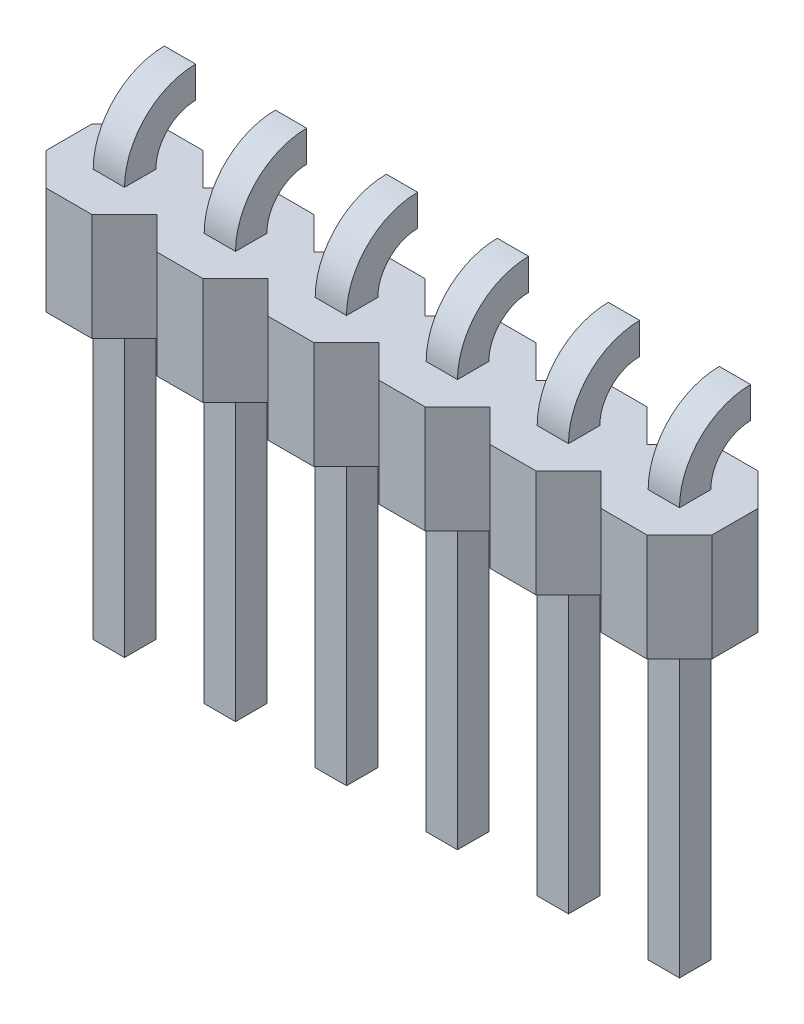
from build123d import *

# Parameters (mm, degrees)
SKETCH1_W                   = 0.7
SKETCH1_H                   = 0.7
BOSS_EXTRUDE1_DEPTH         = 9.1
BOSS_EXTRUDE1_2_DEPTH       = 9.1
BOSS_EXTRUDE1_3_DEPTH       = 9.1
BOSS_EXTRUDE1_4_DEPTH       = 9.1
BOSS_EXTRUDE1_5_DEPTH       = 9.1
BOSS_EXTRUDE1_6_DEPTH       = 9.1
SKETCH3_W                   = 0.7
SKETCH3_H                   = 0.7
Y_KSEKLIK_EKSTR_ZYON1_DEPTH = 2.4
IZIM1_W                     = 0.7
IZIM1_H                     = 0.7
D_ND_R1_ANGLE               = 90


with BuildPart() as part:
    # Sketch1 → Boss-Extrude1 (new body)
    with BuildSketch(Plane(origin=(0, 0, 0), x_dir=(1, 0, 0), z_dir=(0, 1, 0))):
        with Locations((2.48, 0)):
            Rectangle(SKETCH1_W, SKETCH1_H)
    extrude(amount=BOSS_EXTRUDE1_DEPTH)



with BuildPart() as body_2:
    # Sketch1 → Boss-Extrude1 2 (new body)
    with BuildSketch(Plane(origin=(0, 0, 0), x_dir=(1, 0, 0), z_dir=(0, 1, 0))):
        Rectangle(SKETCH1_W, SKETCH1_H)
    extrude(amount=BOSS_EXTRUDE1_2_DEPTH)


with BuildPart() as body_3:
    # Sketch1 → Boss-Extrude1 3 (new body)
    with BuildSketch(Plane(origin=(0, 0, 0), x_dir=(1, 0, 0), z_dir=(0, 1, 0))):
        with Locations((4.96, 0)):
            Rectangle(SKETCH1_W, SKETCH1_H)
    extrude(amount=BOSS_EXTRUDE1_3_DEPTH)


with BuildPart() as body_4:
    # Sketch1 → Boss-Extrude1 4 (new body)
    with BuildSketch(Plane(origin=(0, 0, 0), x_dir=(1, 0, 0), z_dir=(0, 1, 0))):
        with Locations((7.44, 0)):
            Rectangle(SKETCH1_W, SKETCH1_H)
    extrude(amount=BOSS_EXTRUDE1_4_DEPTH)


with BuildPart() as body_5:
    # Sketch1 → Boss-Extrude1 5 (new body)
    with BuildSketch(Plane(origin=(0, 0, 0), x_dir=(1, 0, 0), z_dir=(0, 1, 0))):
        with Locations((9.92, 0)):
            Rectangle(SKETCH1_W, SKETCH1_H)
    extrude(amount=BOSS_EXTRUDE1_5_DEPTH)


with BuildPart() as body_6:
    # Sketch1 → Boss-Extrude1 6 (new body)
    with BuildSketch(Plane(origin=(0, 0, 0), x_dir=(1, 0, 0), z_dir=(0, 1, 0))):
        with Locations((12.4, 0)):
            Rectangle(SKETCH1_W, SKETCH1_H)
    extrude(amount=BOSS_EXTRUDE1_6_DEPTH)


with BuildPart() as part_1:
    add(part.part)

    add(body_2.part)  # Yükseklik-Ekstrüzyon1 merges body 2

    add(body_3.part)  # Yükseklik-Ekstrüzyon1 merges body 3

    add(body_4.part)  # Yükseklik-Ekstrüzyon1 merges body 4

    add(body_5.part)  # Yükseklik-Ekstrüzyon1 merges body 5

    add(body_6.part)  # Yükseklik-Ekstrüzyon1 merges body 6
    # Sketch3 → Yükseklik-Ekstrüzyon1 (add)
    with BuildSketch(Plane(origin=(0, 9.1, 0), x_dir=(1, 0, 0), z_dir=(0, 1, 0))):
        Polygon((0.513624817, 1.24), (-0.513624817, 1.24), (-1.24, 0.513624817), (-1.24, -0.513624817), (-0.513624817, -1.24), (0.513624817, -1.24), (1.24, -0.513624817), (1.966375183, -1.24), (2.993624817, -1.24), (3.72, -0.513624817), (4.446375183, -1.24), (5.473624817, -1.24), (6.2, -0.513624817), (6.926375183, -1.24), (7.953624817, -1.24), (8.68, -0.513624817), (9.406375183, -1.24), (10.433624817, -1.24), (11.16, -0.513624817), (11.886375183, -1.24), (12.913624817, -1.24), (13.64, -0.513624817), (13.64, 0.513624817), (12.913624817, 1.24), (11.886375183, 1.24), (11.16, 0.513624817), (10.433624817, 1.24), (9.406375183, 1.24), (8.68, 0.513624817), (7.953624817, 1.24), (6.926375183, 1.24), (6.2, 0.513624817), (5.473624817, 1.24), (4.446375183, 1.24), (3.72, 0.513624817), (2.993624817, 1.24), (1.966375183, 1.24), (1.24, 0.513624817), align=None)
        Rectangle(SKETCH3_W, SKETCH3_H, mode=Mode.SUBTRACT)
        with Locations((2.48, 0)):
            Rectangle(SKETCH3_W, SKETCH3_H, mode=Mode.SUBTRACT)
        with Locations((12.4, 0)):
            Rectangle(SKETCH3_W, SKETCH3_H, mode=Mode.SUBTRACT)
    extrude(amount=-Y_KSEKLIK_EKSTR_ZYON1_DEPTH)

    # Çizim1 → Döndür1 (revolve)
    with BuildSketch(Plane(origin=(0, 9.1, 0), x_dir=(1, 0, 0), z_dir=(0, 1, 0))):
        with Locations((9.92, 0)):
            Rectangle(IZIM1_W, IZIM1_H)
        with Locations((12.4, 0)):
            Rectangle(IZIM1_W, IZIM1_H)
        with Locations((7.44, 0)):
            Rectangle(IZIM1_W, IZIM1_H)
        with Locations((4.96, 0)):
            Rectangle(IZIM1_W, IZIM1_H)
        with Locations((2.48, 0)):
            Rectangle(IZIM1_W, IZIM1_H)
        Rectangle(IZIM1_W, IZIM1_H)
    revolve(axis=Axis((0, 9.1, -1.24), (-1, 0, 0)), revolution_arc=D_ND_R1_ANGLE)


solid = part_1.part
